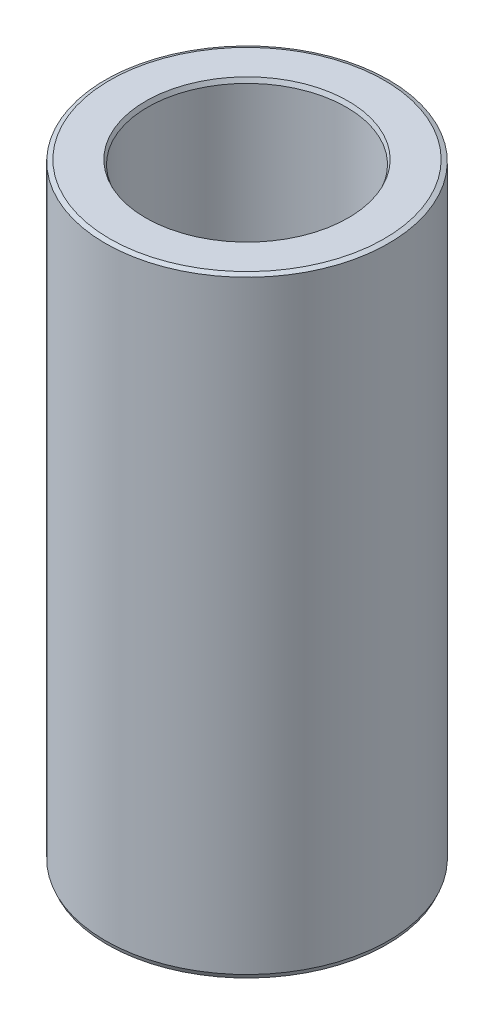
from build123d import *
from OCP.BRepFilletAPI import BRepFilletAPI_MakeChamfer

# Parameters (mm, degrees)
SKETCH1_R           = 45
BOSS_EXTRUDE1_DEPTH = 193.804306536
SKETCH2_R           = 31.577723596
CUT_EXTRUDE1_DEPTH  = 204.985561332
CHAMFER1_SIZE       = 0.588438748
CHAMFER1_SIZE2      = 1.384861476


with BuildPart() as part:
    # Sketch1 → Boss-Extrude1 (new body)
    with BuildSketch(Plane(origin=(0, 0, 0), x_dir=(1, 0, 0), z_dir=(0, 1, 0))):
        Circle(SKETCH1_R)
    extrude(amount=BOSS_EXTRUDE1_DEPTH)

    # Sketch2 → Cut-Extrude1 (cut, through all)
    with BuildSketch(Plane(origin=(0, 0, 0), x_dir=(1, 0, 0), z_dir=(0, 1, 0))):
        Circle(SKETCH2_R)
    extrude(amount=CUT_EXTRUDE1_DEPTH, mode=Mode.SUBTRACT)

    # Chamfer1: one chamfer whose edges measure the first distance from different faces: ONE call of the kernel's chamfer builder (chamfer() names one face for all edges)
    chamfer1_edges_1 = [part.edges().sort_by_distance(p)[0] for p in [
        (-31.577723596, 193.804306536, 0),
    ]]
    chamfer1_side_1 = [part.faces().sort_by_distance(p)[0] for p in [
        (-43.727207794, 193.804306536, 0),
    ]]
    chamfer1_edges_2 = [part.edges().sort_by_distance(p)[0] for p in [
        (-31.577723596, 0, 0),
    ]]
    chamfer1_side_2 = [part.faces().sort_by_distance(p)[0] for p in [
        (-31.577723596, 96.902153268, 0),
    ]]
    chamfer1_edges_3 = [part.edges().sort_by_distance(p)[0] for p in [
        (-45, 0, 0),
    ]]
    chamfer1_side_3 = [part.faces().sort_by_distance(p)[0] for p in [
        (-43.727207794, 0, 0),
    ]]
    chamfer1_edges_4 = [part.edges().sort_by_distance(p)[0] for p in [
        (-45, 193.804306536, 0),
    ]]
    chamfer1_side_4 = [part.faces().sort_by_distance(p)[0] for p in [
        (-45, 96.902153268, 0),
    ]]
    chamfer1 = BRepFilletAPI_MakeChamfer(part.part.solid().wrapped)
    for e in chamfer1_edges_1:
        chamfer1.Add(CHAMFER1_SIZE, CHAMFER1_SIZE2, e.wrapped, chamfer1_side_1[0].wrapped)  # the first distance lies on this face
    for e in chamfer1_edges_2:
        chamfer1.Add(CHAMFER1_SIZE, CHAMFER1_SIZE2, e.wrapped, chamfer1_side_2[0].wrapped)  # the first distance lies on this face
    for e in chamfer1_edges_3:
        chamfer1.Add(CHAMFER1_SIZE, CHAMFER1_SIZE2, e.wrapped, chamfer1_side_3[0].wrapped)  # the first distance lies on this face
    for e in chamfer1_edges_4:
        chamfer1.Add(CHAMFER1_SIZE, CHAMFER1_SIZE2, e.wrapped, chamfer1_side_4[0].wrapped)  # the first distance lies on this face
    add(Compound.cast(chamfer1.Shape()), mode=Mode.REPLACE)


solid = part.part
